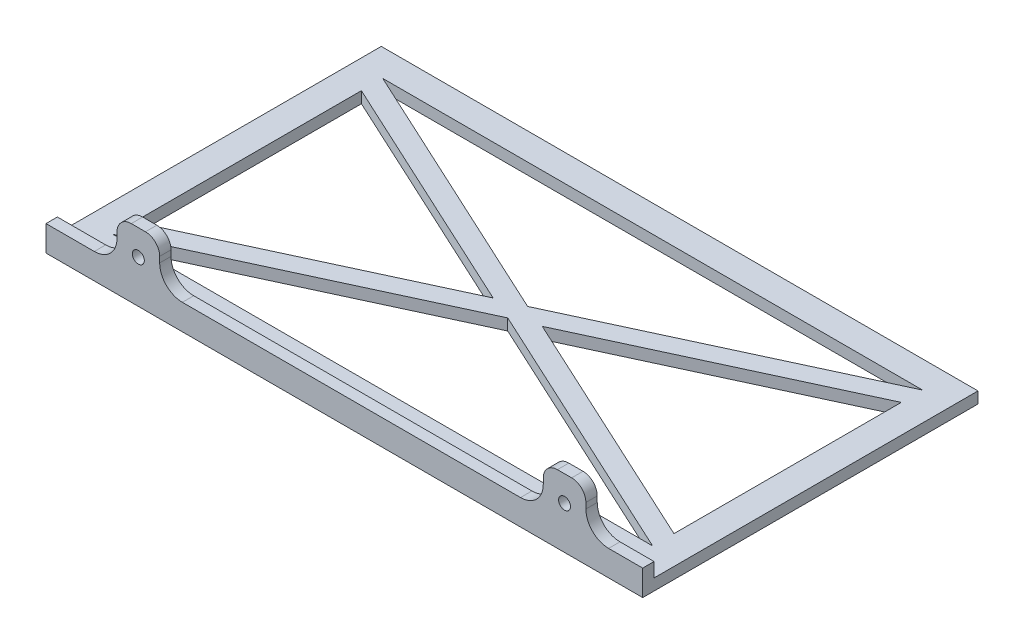
from build123d import *

# Parameters (mm, degrees)
SKETCH_1_W          = 210
SKETCH_1_H          = 114
EXTRUDE_1_DEPTH     = 4
CUT_EXTRUDE_1_DEPTH = 172.073391379
SKETCH_5_W          = 210
SKETCH_5_H          = 9
EXTRUDE_3_DEPTH     = 4
SKETCH_6_W          = 15
SKETCH_6_H          = 15
EXTRUDE_4_DEPTH     = 4
FILLET_1_R          = 8
FILLET_2_R          = 5
SKETCH_7_R          = 2.1
CUT_EXTRUDE_2_DEPTH = 192.791079689


with BuildPart() as part:
    # Эскиз1 → Бобышка-Вытянуть1 (new body)
    with BuildSketch(Plane(origin=(0, 0, 0), x_dir=(1, 0, 0), z_dir=(0, 1, 0))):
        with Locations((-44.277654886, 26.464285714)):
            Rectangle(SKETCH_1_W, SKETCH_1_H)
    extrude(amount=EXTRUDE_1_DEPTH)

    # Эскиз2 → Вырез-Вытянуть1 (cut, through all)
    with BuildSketch(Plane(origin=(0, 4, 0), x_dir=(1, 0, 0), z_dir=(0, 1, 0))):
        Polygon((-139.277654886, 73.964285714), (50.722345114, 73.964285714), (-44.277654886, 29.964285714), align=None)
        Polygon((-139.277654886, -21.035714286), (50.722345114, -21.035714286), (-44.277654886, 22.964285714), align=None)
        Polygon((-139.277654886, 66.464285714), (-52.914018522, 26.464285714), (-139.277654886, -13.535714286), align=None)
        Polygon((-35.64129125, 26.464285714), (50.722345114, 66.464285714), (50.722345114, -13.535714286), align=None)
    extrude(amount=-CUT_EXTRUDE_1_DEPTH, mode=Mode.SUBTRACT)

    # Эскиз5 → Бобышка-Вытянуть3 (add)
    with BuildSketch(Plane.XY.offset(30.535714286)):
        with Locations((-44.277654886, 4.5)):
            Rectangle(SKETCH_5_W, SKETCH_5_H)
    extrude(amount=EXTRUDE_3_DEPTH)

    # Эскиз6 → Бобышка-Вытянуть4 (add)
    with BuildSketch(Plane.XY.offset(34.535714286)):
        with Locations((-116.777654886, 16.5)):
            Rectangle(SKETCH_6_W, SKETCH_6_H)
        with Locations((33.222345114, 16.5)):
            Rectangle(SKETCH_6_W, SKETCH_6_H)
    extrude(amount=-EXTRUDE_4_DEPTH)

    # Скругление1
    fillet_1_edges = [part.edges().sort_by_distance(p)[0] for p in [
        (25.722345114, 9, 32.535714286),
        (40.722345114, 9, 32.535714286),
        (-109.277654886, 9, 32.535714286),
        (-124.277654886, 9, 32.535714286),
    ]]
    fillet(fillet_1_edges, radius=FILLET_1_R)

    # Скругление2
    fillet_2_edges = [part.edges().sort_by_distance(p)[0] for p in [
        (40.722345114, 24, 32.535714286),
        (25.722345114, 24, 32.535714286),
        (-109.277654886, 24, 32.535714286),
        (-124.277654886, 24, 32.535714286),
    ]]
    fillet(fillet_2_edges, radius=FILLET_2_R)

    # Эскиз7 → Вырез-Вытянуть2 (cut, through all)
    with BuildSketch(Plane.XY.offset(34.535714286)):
        with Locations((-116.777654886, 15)):
            Circle(SKETCH_7_R)
        with Locations((33.222345114, 15)):
            Circle(SKETCH_7_R)
    extrude(amount=-CUT_EXTRUDE_2_DEPTH, mode=Mode.SUBTRACT)


solid = part.part
